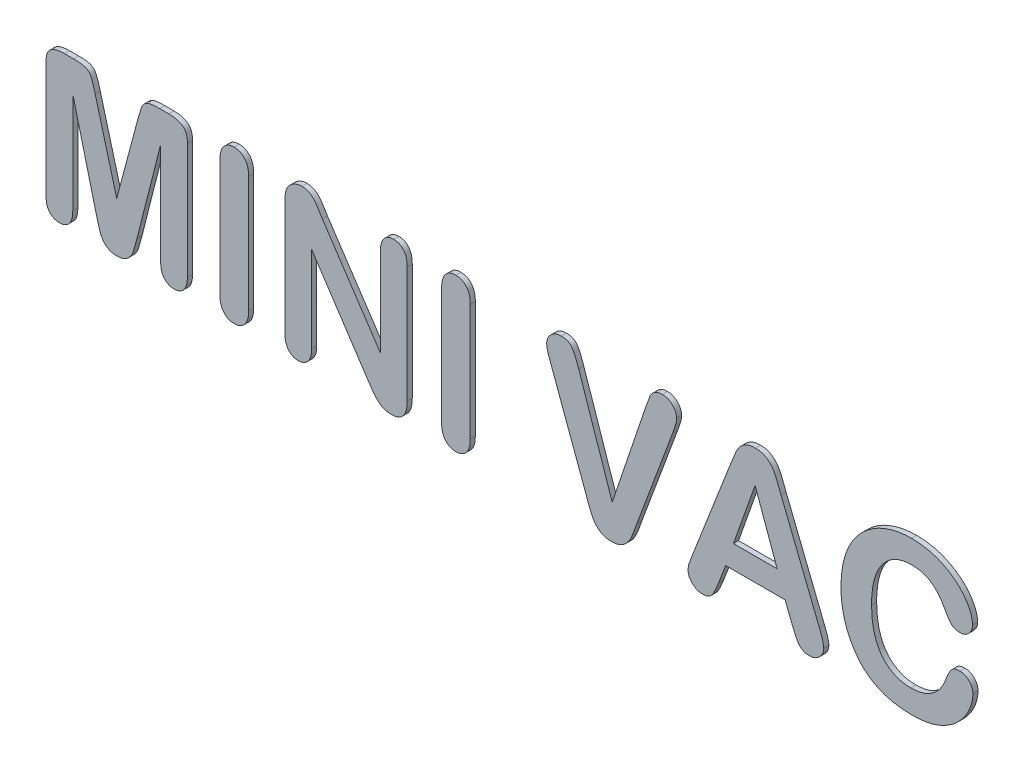
from build123d import *

# Parameters (mm, degrees)
MINI_VAC_DEPTH   = 1
MINI_VAC_2_DEPTH = 1
MINI_VAC_3_DEPTH = 1
MINI_VAC_4_DEPTH = 1
MINI_VAC_5_DEPTH = 1
MINI_VAC_6_DEPTH = 1
MINI_VAC_7_DEPTH = 1


with BuildPart() as part:
    # Sketch7 → Mini Vac (new body)
    with BuildSketch(Plane.XY):
        with BuildLine():
            Line((-80.642578125, -10.529296875), (-85.3125, 7.875))
            Line((-85.3125, 7.875), (-85.3125, -12.064453125))
            add(Edge.make_bspline(
                [(-85.3125, -12.064453125), (-85.32034702, -12.32500066), (-85.335043204, -12.812963521), (-85.472247997, -13.494771432), (-85.686102404, -14.080718367), (-86.012322646, -14.555773673), (-86.408775185, -14.923516324), (-86.867808028, -15.191623767), (-87.390721283, -15.346024223), (-87.75874176, -15.365117737), (-87.94921875, -15.375)],
                knots=[0, 0, 0, 0, 1.30362474, 2.441475632, 3.469867302, 4.406120522, 5.299256138, 6.158467928, 7.046875082, 8, 8, 8, 8], degree=3))
            add(Edge.make_bspline(
                [(-87.94921875, -15.375), (-88.133969739, -15.36523301), (-88.492628272, -15.346272275), (-89.002813758, -15.187900018), (-89.45986042, -14.930237159), (-89.8591632, -14.567396788), (-90.178253139, -14.093533639), (-90.408277762, -13.515206628), (-90.538119039, -12.83186005), (-90.55403496, -12.342370893), (-90.5625, -12.08203125)],
                knots=[0, 0, 0, 0, 0.931401934, 1.808137819, 2.66942439, 3.563139973, 4.50699297, 5.529036112, 6.685793447, 8, 8, 8, 8], degree=3))
            Line((-90.5625, -12.08203125), (-90.5625, 10.67578125))
            add(Edge.make_bspline(
                [(-90.5625, 10.67578125), (-90.558224811, 10.826232174), (-90.549991456, 11.115977498), (-90.512751288, 11.532263713), (-90.436944469, 11.911734407), (-90.326713542, 12.249314653), (-90.188860856, 12.549961029), (-90.027660667, 12.816862312), (-89.825937933, 13.04208306), (-89.510335979, 13.288096071), (-89.049596367, 13.527245272), (-88.424440329, 13.732424457), (-87.715612739, 13.854276695), (-87.215338068, 13.867873431), (-86.953125, 13.875)],
                knots=[0, 0, 0, 0, 0.969665939, 1.867427353, 2.689218696, 3.457225703, 4.149776576, 4.816702983, 5.458338976, 6.085245707, 7.385799533, 8.77853966, 10.311509556, 12, 12, 12, 12], degree=3))
            Line((-86.953125, 13.875), (-85.154296875, 13.875))
            add(Edge.make_bspline(
                [(-85.154296875, 13.875), (-84.902289988, 13.871885983), (-84.434733728, 13.866108449), (-83.789417401, 13.818949073), (-83.255681479, 13.726399776), (-82.817762843, 13.602271368), (-82.45947283, 13.416479763), (-82.155666276, 13.181333259), (-81.905334268, 12.879866062), (-81.702148799, 12.509506428), (-81.520848309, 12.052094429), (-81.331630684, 11.48902961), (-81.118314464, 10.810827038), (-80.987976868, 10.315098407), (-80.91796875, 10.048828125)],
                knots=[0, 0, 0, 0, 1.38803647, 2.575267475, 3.558583177, 4.368440808, 5.070869684, 5.768090105, 6.470518981, 7.212366556, 8.085347214, 9.177334938, 10.483864409, 12, 12, 12, 12], degree=3))
            Line((-80.91796875, 10.048828125), (-76.6875, -5.625))
            Line((-76.6875, -5.625), (-72.509765625, 10.048828125))
            add(Edge.make_bspline(
                [(-72.509765625, 10.048828125), (-72.439730708, 10.315082929), (-72.309343218, 10.810782743), (-72.096344278, 11.489168564), (-71.906205955, 12.051701624), (-71.72709811, 12.51149353), (-71.515641778, 12.878226363), (-71.266609902, 13.181583984), (-70.96226999, 13.416330904), (-70.602583925, 13.603511188), (-70.160099651, 13.725992249), (-69.62074615, 13.818997251), (-68.971491157, 13.865918867), (-68.502000405, 13.871828167), (-68.25, 13.875)],
                knots=[0, 0, 0, 0, 1.511478991, 2.813995637, 3.902629473, 4.772928891, 5.517843496, 6.218114959, 6.913193965, 7.613465427, 8.431097637, 9.421953472, 10.616226692, 12, 12, 12, 12], degree=3))
            Line((-68.25, 13.875), (-66.4453125, 13.875))
            add(Edge.make_bspline(
                [(-66.4453125, 13.875), (-66.181174544, 13.867803463), (-65.677074038, 13.854069056), (-64.963988241, 13.733333249), (-64.33741356, 13.526946306), (-63.875615132, 13.288761489), (-63.561037854, 13.040158003), (-63.352162019, 12.819285302), (-63.194119984, 12.547995226), (-63.044565896, 12.252298128), (-62.94827577, 11.909396421), (-62.859218487, 11.533433686), (-62.82587644, 11.115760128), (-62.81707182, 10.826157881), (-62.8125, 10.67578125)],
                knots=[0, 0, 0, 0, 1.69575107, 3.236297379, 4.624693315, 5.921190494, 6.546141798, 7.194208304, 7.859054455, 8.55478081, 9.316580419, 10.138397467, 11.033358612, 12, 12, 12, 12], degree=3))
            Line((-62.8125, 10.67578125), (-62.8125, -12.08203125))
            add(Edge.make_bspline(
                [(-62.8125, -12.08203125), (-62.820570537, -12.340567609), (-62.835738501, -12.826467177), (-62.97087152, -13.505150767), (-63.187998283, -14.087568046), (-63.510368049, -14.561667396), (-63.911737649, -14.925014816), (-64.373873344, -15.191724292), (-64.902566991, -15.345987173), (-65.274385115, -15.365106144), (-65.466796875, -15.375)],
                knots=[0, 0, 0, 0, 1.293518314, 2.431070022, 3.450077594, 4.386084638, 5.272371044, 6.139835868, 7.037385671, 8, 8, 8, 8], degree=3))
            add(Edge.make_bspline(
                [(-65.466796875, -15.375), (-65.649533165, -15.365101303), (-66.004243776, -15.345886877), (-66.51069347, -15.189036409), (-66.961114104, -14.921806724), (-67.357345583, -14.556084434), (-67.681715015, -14.07940898), (-67.904657324, -13.49629044), (-68.039333442, -12.812714991), (-68.054435998, -12.32491415), (-68.0625, -12.064453125)],
                knots=[0, 0, 0, 0, 0.922456205, 1.790585791, 2.649061979, 3.550299627, 4.495046019, 5.536376652, 6.684549498, 8, 8, 8, 8], degree=3))
            Line((-68.0625, -12.064453125), (-68.0625, 7.875))
            Line((-68.0625, 7.875), (-72.732421875, -10.529296875))
            add(Edge.make_bspline(
                [(-72.732421875, -10.529296875), (-72.803516938, -10.808897971), (-72.935570486, -11.328235248), (-73.135608243, -12.044458996), (-73.313178443, -12.641495873), (-73.461462438, -13.144959233), (-73.644935953, -13.577997587), (-73.879895499, -13.975150031), (-74.188049989, -14.343503114), (-74.535324782, -14.703429092), (-74.963056172, -15.009540968), (-75.471970202, -15.226355236), (-76.056053086, -15.356111613), (-76.469989365, -15.368493633), (-76.6875, -15.375)],
                knots=[0, 0, 0, 0, 1.501096557, 2.788170037, 3.868651286, 4.742863802, 5.516817816, 6.309819568, 7.133547599, 8.010237478, 8.906902995, 9.849006967, 10.869720086, 12, 12, 12, 12], degree=3))
            add(Edge.make_bspline(
                [(-76.6875, -15.375), (-76.853895408, -15.369406683), (-77.175155416, -15.358607653), (-77.636088086, -15.27506555), (-78.060020607, -15.141454683), (-78.441552081, -14.945963447), (-78.780636227, -14.706277588), (-79.076100301, -14.429508999), (-79.343676579, -14.135082446), (-79.632141698, -13.684984669), (-79.926144158, -13.066444917), (-80.186675225, -12.25953491), (-80.401640313, -11.403082144), (-80.56133994, -10.823915343), (-80.642578125, -10.529296875)],
                knots=[0, 0, 0, 0, 0.868933015, 1.67765103, 2.439282522, 3.183205666, 3.908055228, 4.601401517, 5.295498424, 5.980457608, 7.386244959, 8.861049734, 10.403235965, 12, 12, 12, 12], degree=3))
        make_face()
    extrude(amount=MINI_VAC_DEPTH)


with BuildPart() as body_2:
    # Sketch7 → Mini Vac 2 (new body)
    with BuildSketch(Plane.XY):
        with BuildLine():
            Line((-56.4375, -11.794921875), (-56.4375, 11.0625))
            add(Edge.make_bspline(
                [(-56.4375, 11.0625), (-56.430638717, 11.342671712), (-56.417764505, 11.868373735), (-56.268101351, 12.601462681), (-56.03654494, 13.231493536), (-55.685845466, 13.739320795), (-55.268088915, 14.140980808), (-54.777953313, 14.420579214), (-54.234995473, 14.600332523), (-53.851060694, 14.616641676), (-53.654296875, 14.625)],
                knots=[0, 0, 0, 0, 1.314663, 2.466776515, 3.501452278, 4.446007437, 5.34208644, 6.201692853, 7.078380494, 8, 8, 8, 8], degree=3))
            add(Edge.make_bspline(
                [(-53.654296875, 14.625), (-53.451685703, 14.616809267), (-53.058173778, 14.600901204), (-52.501769748, 14.420745199), (-52.002783417, 14.142773752), (-51.574032115, 13.745677552), (-51.221709347, 13.238877882), (-50.978033281, 12.611389166), (-50.833290693, 11.873802766), (-50.819726304, 11.344487722), (-50.8125, 11.0625)],
                knots=[0, 0, 0, 0, 0.939704012, 1.825095485, 2.692007845, 3.579728686, 4.520135675, 5.539530793, 6.689207656, 8, 8, 8, 8], degree=3))
            Line((-50.8125, 11.0625), (-50.8125, -11.794921875))
            add(Edge.make_bspline(
                [(-50.8125, -11.794921875), (-50.819668588, -12.076915635), (-50.833124639, -12.606242012), (-50.978929329, -13.345541456), (-51.222001096, -13.976358479), (-51.571802845, -14.489909639), (-52.004830195, -14.885123764), (-52.498761272, -15.174054966), (-53.059903364, -15.341311556), (-53.452021416, -15.363535633), (-53.654296875, -15.375)],
                knots=[0, 0, 0, 0, 1.307751878, 2.454761992, 3.480206064, 4.425894871, 5.311556588, 6.180961951, 7.061642901, 8, 8, 8, 8], degree=3))
            add(Edge.make_bspline(
                [(-53.654296875, -15.375), (-53.848750482, -15.363353198), (-54.227400325, -15.34067396), (-54.769930172, -15.174201125), (-55.249772476, -14.879832036), (-55.675973041, -14.4842664), (-56.031616723, -13.970760483), (-56.259338684, -13.334687376), (-56.420241387, -12.601727644), (-56.431502791, -12.07527947), (-56.4375, -11.794921875)],
                knots=[0, 0, 0, 0, 0.912572231, 1.777006537, 2.632638816, 3.534642503, 4.491136576, 5.533474522, 6.686463005, 8, 8, 8, 8], degree=3))
        make_face()
    extrude(amount=MINI_VAC_2_DEPTH)


with BuildPart() as body_3:
    # Sketch7 → Mini Vac 3 (new body)
    with BuildSketch(Plane.XY):
        with BuildLine():
            Line((-36.33984375, 11.103515625), (-24.9375, -6))
            Line((-24.9375, -6), (-24.9375, 11.26171875))
            add(Edge.make_bspline(
                [(-24.9375, 11.26171875), (-24.928697466, 11.525938907), (-24.912209928, 12.020835033), (-24.78695397, 12.714726134), (-24.567478983, 13.303340874), (-24.25646713, 13.786711922), (-23.869785214, 14.164771038), (-23.413214659, 14.433347952), (-22.895735525, 14.597940159), (-22.530542237, 14.61577981), (-22.341796875, 14.625)],
                knots=[0, 0, 0, 0, 1.319117216, 2.470765316, 3.505116792, 4.43580569, 5.318756254, 6.18027265, 7.059497782, 8, 8, 8, 8], degree=3))
            add(Edge.make_bspline(
                [(-22.341796875, 14.625), (-22.147308708, 14.615606677), (-21.770859331, 14.597425053), (-21.238490423, 14.436183197), (-20.773198147, 14.164818617), (-20.380397186, 13.787266712), (-20.063715887, 13.30387908), (-19.836534268, 12.715983917), (-19.713290045, 12.020664749), (-19.696476556, 11.525879638), (-19.6875, 11.26171875)],
                knots=[0, 0, 0, 0, 0.959871134, 1.857917088, 2.719075999, 3.600089629, 4.526699118, 5.554128738, 6.694173474, 8, 8, 8, 8], degree=3))
            Line((-19.6875, 11.26171875), (-19.6875, -11.5546875))
            add(Edge.make_bspline(
                [(-19.6875, -11.5546875), (-19.694738264, -11.85418102), (-19.708323647, -12.416295692), (-19.853060568, -13.20227919), (-20.097149154, -13.871296534), (-20.43866617, -14.426385705), (-20.888152229, -14.861885499), (-21.443828562, -15.161225781), (-22.091707736, -15.348184467), (-22.55526269, -15.365763473), (-22.798828125, -15.375)],
                knots=[0, 0, 0, 0, 1.276164049, 2.395212213, 3.391561633, 4.297456637, 5.151673506, 6.027862746, 6.963780962, 8, 8, 8, 8], degree=3))
            add(Edge.make_bspline(
                [(-22.798828125, -15.375), (-23.04576548, -15.363413763), (-23.522041551, -15.341067014), (-24.208166679, -15.177915778), (-24.832007481, -14.873539695), (-25.392540568, -14.43343074), (-25.917288605, -13.899653001), (-26.397611967, -13.280521353), (-26.850145236, -12.609747646), (-27.159867422, -12.158005576), (-27.31640625, -11.9296875)],
                knots=[0, 0, 0, 0, 0.990229924, 1.909888509, 2.806876858, 3.75171819, 4.754420985, 5.802993103, 6.889595585, 8, 8, 8, 8], degree=3))
            Line((-27.31640625, -11.9296875), (-38.4375, 4.875))
            Line((-38.4375, 4.875), (-38.4375, -12.029296875))
            add(Edge.make_bspline(
                [(-38.4375, -12.029296875), (-38.446282155, -12.287632755), (-38.462917794, -12.776986674), (-38.591368554, -13.465102491), (-38.827671505, -14.052638994), (-39.152334188, -14.535807007), (-39.551020474, -14.911743915), (-40.006805024, -15.182392004), (-40.518266476, -15.347449896), (-40.877666928, -15.365643409), (-41.0625, -15.375)],
                knots=[0, 0, 0, 0, 1.293064309, 2.449392962, 3.484384031, 4.441729672, 5.340986808, 6.204611779, 7.076664708, 8, 8, 8, 8], degree=3))
            add(Edge.make_bspline(
                [(-41.0625, -15.375), (-41.25126065, -15.365993602), (-41.61894229, -15.348450288), (-42.139400721, -15.178890228), (-42.597150231, -14.899062074), (-42.996897394, -14.521002828), (-43.307938605, -14.028721179), (-43.530101607, -13.441157134), (-43.663536021, -12.757841322), (-43.679198884, -12.270175406), (-43.6875, -12.01171875)],
                knots=[0, 0, 0, 0, 0.938889884, 1.828837584, 2.693878765, 3.596100726, 4.546832571, 5.570326044, 6.712304089, 8, 8, 8, 8], degree=3))
            Line((-43.6875, -12.01171875), (-43.6875, 10.37109375))
            add(Edge.make_bspline(
                [(-43.6875, 10.37109375), (-43.685301746, 10.595916801), (-43.681145053, 11.021036014), (-43.619664008, 11.619633099), (-43.535650224, 12.146455797), (-43.431505259, 12.461893001), (-43.3828125, 12.609375)],
                knots=[0, 0, 0, 0, 1.18793306, 2.246269525, 3.180047019, 4, 4, 4, 4], degree=3))
            add(Edge.make_bspline(
                [(-43.3828125, 12.609375), (-43.317473183, 12.752881282), (-43.187026876, 13.039383581), (-42.900988709, 13.419010244), (-42.574517488, 13.772823149), (-42.180524041, 14.064311459), (-41.755415513, 14.312047313), (-41.304564876, 14.49514501), (-40.833361118, 14.605060917), (-40.514242503, 14.618321295), (-40.353515625, 14.625)],
                knots=[0, 0, 0, 0, 0.980600708, 1.957714689, 2.948627098, 3.97434472, 5.000279326, 6.011426356, 6.998437519, 8, 8, 8, 8], degree=3))
            add(Edge.make_bspline(
                [(-40.353515625, 14.625), (-40.113342952, 14.615444869), (-39.66297532, 14.597527252), (-39.041974086, 14.390113251), (-38.513318355, 14.086062857), (-38.056160188, 13.671045411), (-37.62390522, 13.158137939), (-37.22328386, 12.525802782), (-36.789457737, 11.831128742), (-36.492001151, 11.349752896), (-36.33984375, 11.103515625)],
                knots=[0, 0, 0, 0, 1.01695463, 1.906975685, 2.751376853, 3.592506721, 4.517315556, 5.594915983, 6.76973195, 8, 8, 8, 8], degree=3))
        make_face()
    extrude(amount=MINI_VAC_3_DEPTH)


with BuildPart() as body_4:
    # Sketch7 → Mini Vac 4 (new body)
    with BuildSketch(Plane.XY):
        with BuildLine():
            Line((-12.9375, -11.794921875), (-12.9375, 11.0625))
            add(Edge.make_bspline(
                [(-12.9375, 11.0625), (-12.930638717, 11.342671712), (-12.917764505, 11.868373735), (-12.768101351, 12.601462681), (-12.53654494, 13.231493536), (-12.185845466, 13.739320795), (-11.768088915, 14.140980808), (-11.277953313, 14.420579214), (-10.734995473, 14.600332523), (-10.351060694, 14.616641676), (-10.154296875, 14.625)],
                knots=[0, 0, 0, 0, 1.314663, 2.466776515, 3.501452278, 4.446007437, 5.34208644, 6.201692853, 7.078380494, 8, 8, 8, 8], degree=3))
            add(Edge.make_bspline(
                [(-10.154296875, 14.625), (-9.951685703, 14.616809267), (-9.558173778, 14.600901204), (-9.001769748, 14.420745199), (-8.502783417, 14.142773752), (-8.074032115, 13.745677552), (-7.721709347, 13.238877882), (-7.478033281, 12.611389166), (-7.333290693, 11.873802766), (-7.319726304, 11.344487722), (-7.3125, 11.0625)],
                knots=[0, 0, 0, 0, 0.939704012, 1.825095485, 2.692007845, 3.579728686, 4.520135675, 5.539530793, 6.689207656, 8, 8, 8, 8], degree=3))
            Line((-7.3125, 11.0625), (-7.3125, -11.794921875))
            add(Edge.make_bspline(
                [(-7.3125, -11.794921875), (-7.319668588, -12.076915635), (-7.333124639, -12.606242012), (-7.478929329, -13.345541456), (-7.722001096, -13.976358479), (-8.071802845, -14.489909639), (-8.504830195, -14.885123764), (-8.998761272, -15.174054966), (-9.559903364, -15.341311556), (-9.952021416, -15.363535633), (-10.154296875, -15.375)],
                knots=[0, 0, 0, 0, 1.307751878, 2.454761992, 3.480206064, 4.425894871, 5.311556588, 6.180961951, 7.061642901, 8, 8, 8, 8], degree=3))
            add(Edge.make_bspline(
                [(-10.154296875, -15.375), (-10.348750482, -15.363353198), (-10.727400325, -15.34067396), (-11.269930172, -15.174201125), (-11.749772476, -14.879832036), (-12.175973041, -14.4842664), (-12.531616723, -13.970760483), (-12.759338684, -13.334687376), (-12.920241387, -12.601727644), (-12.931502791, -12.07527947), (-12.9375, -11.794921875)],
                knots=[0, 0, 0, 0, 0.912572231, 1.777006537, 2.632638816, 3.534642503, 4.491136576, 5.533474522, 6.686463005, 8, 8, 8, 8], degree=3))
        make_face()
    extrude(amount=MINI_VAC_4_DEPTH)


with BuildPart() as body_5:
    # Sketch7 → Mini Vac 5 (new body)
    with BuildSketch(Plane.XY):
        with BuildLine():
            Line((13.95703125, 10.775390625), (20.548828125, -8.625))
            Line((20.548828125, -8.625), (27.15234375, 10.916015625))
            add(Edge.make_bspline(
                [(27.15234375, 10.916015625), (27.23139187, 11.1526998), (27.376783297, 11.588027676), (27.59053756, 12.180160409), (27.762287896, 12.658955548), (27.912727602, 13.039978253), (28.07372604, 13.354525222), (28.268027736, 13.63659312), (28.505444276, 13.900750176), (28.780265662, 14.150809571), (29.109073638, 14.365122853), (29.497742046, 14.515676305), (29.93672058, 14.612124506), (30.24749252, 14.620576219), (30.41015625, 14.625)],
                knots=[0, 0, 0, 0, 1.663677355, 3.059964321, 4.196999397, 5.055473659, 5.789349626, 6.547882397, 7.331919154, 8.152727381, 9.019653913, 9.931296846, 10.917202845, 12, 12, 12, 12], degree=3))
            add(Edge.make_bspline(
                [(30.41015625, 14.625), (30.533551864, 14.620604077), (30.778470991, 14.611878923), (31.138993995, 14.53835959), (31.486304556, 14.421907353), (31.814624983, 14.256599722), (32.117074014, 14.052806973), (32.388794383, 13.816928815), (32.627891384, 13.550594144), (32.880735212, 13.16176469), (33.129302155, 12.649235379), (33.168493789, 12.208081011), (33.1875, 11.994140625)],
                knots=[0, 0, 0, 0, 0.876180247, 1.739067481, 2.603738925, 3.472744031, 4.342746148, 5.188837289, 6.024504381, 6.875250335, 8.484634405, 10, 10, 10, 10], degree=3))
            add(Edge.make_bspline(
                [(33.1875, 11.994140625), (33.181810266, 11.843287212), (33.169815233, 11.525259768), (33.067563828, 11.044590422), (32.934855119, 10.550244911), (32.768097134, 10.060198857), (32.584953617, 9.568152049), (32.47181523, 9.234678404), (32.4140625, 9.064453125)],
                knots=[0, 0, 0, 0, 0.891094485, 1.87859523, 2.895504577, 3.918037669, 4.937239494, 6, 6, 6, 6], degree=3))
            Line((32.4140625, 9.064453125), (25.37109375, -9.890625))
            add(Edge.make_bspline(
                [(25.37109375, -9.890625), (25.24405984, -10.244099655), (24.995183081, -10.936604728), (24.634381159, -11.944996927), (24.238592598, -12.869932822), (23.845566915, -13.561609079), (23.478352024, -14.045832772), (23.16675661, -14.369587075), (22.812033417, -14.657579202), (22.419300256, -14.911708176), (21.98080764, -15.118653513), (21.498820894, -15.271745047), (20.968049453, -15.359816891), (20.599946093, -15.369799904), (20.408203125, -15.375)],
                knots=[0, 0, 0, 0, 1.681776409, 3.294829421, 4.794504194, 6.181843062, 6.842986488, 7.510919311, 8.188344572, 8.884531222, 9.600376859, 10.352632466, 11.141895525, 12, 12, 12, 12], degree=3))
            add(Edge.make_bspline(
                [(20.408203125, -15.375), (20.216318608, -15.370262236), (19.847943507, -15.361166796), (19.318329364, -15.266812289), (18.829043297, -15.135010189), (18.391873541, -14.92199346), (17.996295117, -14.670200812), (17.645859889, -14.37489409), (17.32846118, -14.049314096), (16.960308145, -13.554562247), (16.564220977, -12.85661734), (16.158500334, -11.936299067), (15.794798613, -10.934451867), (15.552118666, -10.24433874), (15.427734375, -9.890625)],
                knots=[0, 0, 0, 0, 0.856404827, 1.644104592, 2.398160278, 3.112588039, 3.807395751, 4.489033182, 5.15564303, 5.834649402, 7.2387151, 8.73098538, 10.324484289, 12, 12, 12, 12], degree=3))
            Line((15.427734375, -9.890625), (8.501953125, 8.90625))
            add(Edge.make_bspline(
                [(8.501953125, 8.90625), (8.442578155, 9.07660316), (8.324814386, 9.41448005), (8.126658798, 9.915594116), (7.954597842, 10.438633025), (7.812843073, 10.971630799), (7.716217687, 11.481193555), (7.69643259, 11.806331484), (7.6875, 11.953125)],
                knots=[0, 0, 0, 0, 1.024828865, 2.032636131, 3.060763648, 4.150798767, 5.165121243, 6, 6, 6, 6], degree=3))
            add(Edge.make_bspline(
                [(7.6875, 11.953125), (7.698119189, 12.11832778), (7.719431703, 12.449886684), (7.879119839, 12.931327481), (8.140110397, 13.386928315), (8.492669656, 13.806033232), (8.921226749, 14.169455975), (9.414206521, 14.439177497), (9.965233513, 14.596193303), (10.348588959, 14.615179576), (10.546875, 14.625)],
                knots=[0, 0, 0, 0, 0.914541686, 1.83546813, 2.780759257, 3.810599709, 4.85568952, 5.877762653, 6.902297996, 8, 8, 8, 8], degree=3))
            add(Edge.make_bspline(
                [(10.546875, 14.625), (10.780586987, 14.615120568), (11.218069173, 14.596627398), (11.823143347, 14.4254167), (12.327235308, 14.137548311), (12.702981468, 13.694833282), (13.016408959, 13.14667011), (13.331836779, 12.478843386), (13.651096886, 11.67542624), (13.850466362, 11.088896415), (13.95703125, 10.775390625)],
                knots=[0, 0, 0, 0, 0.996023746, 1.864442861, 2.661172804, 3.434868426, 4.310268675, 5.354837269, 6.586135273, 8, 8, 8, 8], degree=3))
        make_face()
    extrude(amount=MINI_VAC_5_DEPTH)


with BuildPart() as body_6:
    # Sketch7 → Mini Vac 6 (new body)
    with BuildSketch(Plane.XY):
        with BuildLine():
            Line((55.857421875, -11.748046875), (54.486328125, -8.25))
            Line((54.486328125, -8.25), (42.8203125, -8.25))
            Line((42.8203125, -8.25), (41.44921875, -11.82421875))
            add(Edge.make_bspline(
                [(41.44921875, -11.82421875), (41.323320189, -12.145761274), (41.092568487, -12.735096723), (40.734913745, -13.525500667), (40.41072569, -14.148374662), (40.11010715, -14.632122254), (39.759460605, -14.988782463), (39.319773263, -15.217282574), (38.795010592, -15.351859021), (38.416918186, -15.366939904), (38.21484375, -15.375)],
                knots=[0, 0, 0, 0, 1.589179946, 2.912709847, 3.990397165, 4.820646782, 5.526248733, 6.26234321, 7.071295771, 8, 8, 8, 8], degree=3))
            add(Edge.make_bspline(
                [(38.21484375, -15.375), (38.035938456, -15.364917991), (37.683129334, -15.345035826), (37.173169162, -15.183636421), (36.697095397, -14.926246776), (36.26519746, -14.578337743), (35.900446272, -14.167501273), (35.636127517, -13.71074287), (35.466612065, -13.226548741), (35.447244899, -12.890028605), (35.4375, -12.720703125)],
                knots=[0, 0, 0, 0, 1.012468346, 1.996632184, 3.002236258, 4.065667855, 5.124941345, 6.097262832, 7.042607408, 8, 8, 8, 8], degree=3))
            add(Edge.make_bspline(
                [(35.4375, -12.720703125), (35.446531553, -12.518706445), (35.465084047, -12.103767617), (35.597051481, -11.580527955), (35.755494163, -11.128146158), (35.901888745, -10.717866543), (36.075772262, -10.243694481), (36.209968913, -9.909784482), (36.28125, -9.732421875)],
                knots=[0, 0, 0, 0, 1.162779838, 2.388566498, 3.08974091, 3.926345762, 4.898539362, 6, 6, 6, 6], degree=3))
            Line((36.28125, -9.732421875), (43.623046875, 9.10546875))
            add(Edge.make_bspline(
                [(43.623046875, 9.10546875), (43.677334086, 9.248202136), (43.790545929, 9.545861743), (43.976567651, 10.010205938), (44.165386959, 10.51858401), (44.373060625, 11.052262188), (44.584385364, 11.586763864), (44.822317755, 12.081944487), (45.051898506, 12.536552895), (45.301148972, 12.941351118), (45.5726851, 13.306862013), (45.883855799, 13.629693717), (46.236506499, 13.912974868), (46.622593675, 14.169049235), (47.057767305, 14.37445966), (47.540925904, 14.521726252), (48.071007065, 14.609671426), (48.441058621, 14.619768094), (48.6328125, 14.625)],
                knots=[0, 0, 0, 0, 0.906149852, 1.889706515, 2.96811083, 4.12389095, 5.288239382, 6.376994434, 7.382631969, 8.308939681, 9.194397083, 10.07962691, 10.961131357, 11.874074475, 12.822804478, 13.805267996, 14.862730428, 16, 16, 16, 16], degree=3))
            add(Edge.make_bspline(
                [(48.6328125, 14.625), (48.826542868, 14.619821261), (49.200521882, 14.609824171), (49.736037237, 14.521096731), (50.222844318, 14.377508473), (50.654172446, 14.166496196), (51.043033858, 13.917869884), (51.396886615, 13.639146226), (51.704680194, 13.316984387), (52.06123778, 12.844477868), (52.444836054, 12.204133288), (52.765764992, 11.513065873), (52.998468564, 10.904860194), (53.216124591, 10.38367412), (53.439991862, 9.785343641), (53.599484932, 9.363228049), (53.68359375, 9.140625)],
                knots=[0, 0, 0, 0, 1.005463131, 1.940955953, 2.810500616, 3.631666672, 4.42517864, 5.204561669, 5.964968357, 6.731842121, 8.274852444, 9.831306624, 10.68267648, 11.656482744, 12.764143998, 14, 14, 14, 14], degree=3))
            Line((53.68359375, 9.140625), (61.18359375, -9.57421875))
            add(Edge.make_bspline(
                [(61.18359375, -9.57421875), (61.252154058, -9.74599155), (61.38417767, -10.076766984), (61.570904869, -10.554291103), (61.710122474, -11.002177809), (61.848602189, -11.405951833), (61.937016386, -11.780088302), (62.010409867, -12.113213195), (62.055767921, -12.410839694), (62.060342864, -12.59752342), (62.0625, -12.685546875)],
                knots=[0, 0, 0, 0, 1.36622511, 2.630880465, 3.785062113, 4.829837655, 5.781525877, 6.621841003, 7.350182692, 8, 8, 8, 8], degree=3))
            add(Edge.make_bspline(
                [(62.0625, -12.685546875), (62.051724288, -12.850660922), (62.030097634, -13.182041739), (61.871657682, -13.66834053), (61.596581711, -14.123425801), (61.240179644, -14.550145385), (60.811335258, -14.916062596), (60.320542352, -15.181981906), (59.787713158, -15.34588331), (59.415215921, -15.365211251), (59.2265625, -15.375)],
                knots=[0, 0, 0, 0, 0.918533131, 1.843478885, 2.81316186, 3.862812883, 4.927781559, 5.930017069, 6.951644948, 8, 8, 8, 8], degree=3))
            add(Edge.make_bspline(
                [(59.2265625, -15.375), (59.012270917, -15.365584078), (58.608531659, -15.347843871), (58.050233773, -15.167699728), (57.592716081, -14.87336917), (57.26930485, -14.558612739), (57.046810106, -14.244709812), (56.871757642, -13.956363404), (56.690881182, -13.615502228), (56.450012029, -13.10562055), (56.178893851, -12.474090294), (55.959387308, -11.978335475), (55.857421875, -11.748046875)],
                knots=[0, 0, 0, 0, 1.202315025, 2.265239587, 3.252603888, 4.239051274, 4.781746036, 5.412840692, 6.135219166, 6.950797606, 8.583580985, 10, 10, 10, 10], degree=3))
        make_face()
        Polygon((44.34375, -3.75), (52.921875, -3.75), (48.591796875, 8.25), align=None, mode=Mode.SUBTRACT)
    extrude(amount=MINI_VAC_6_DEPTH)


with BuildPart() as body_7:
    # Sketch7 → Mini Vac 7 (new body)
    with BuildSketch(Plane.XY):
        with BuildLine():
            add(Edge.make_bspline(
                [(91.330078125, -5.806640625), (91.322119375, -6.039622355), (91.305686748, -6.520665442), (91.167486766, -7.252410105), (90.955834875, -8.013744669), (90.65489058, -8.795824573), (90.272694802, -9.593558912), (89.777238725, -10.382167475), (89.190893309, -11.167182791), (88.50828771, -11.93885052), (87.728217095, -12.671353716), (86.836629631, -13.33321547), (85.846234667, -13.921650159), (84.758312685, -14.439999446), (83.573505866, -14.866203895), (82.284974229, -15.159151901), (80.905856427, -15.345441349), (79.953755875, -15.364971231), (79.46484375, -15.375)],
                knots=[0, 0, 0, 0, 0.663733519, 1.370426865, 2.116139696, 2.914458905, 3.756161797, 4.633801399, 5.564768272, 6.546895284, 7.567232022, 8.609557965, 9.705783212, 10.846455846, 12.040496113, 13.287086875, 14.606894913, 16, 16, 16, 16], degree=3))
            add(Edge.make_bspline(
                [(79.46484375, -15.375), (79.091609439, -15.371863914), (78.361755311, -15.365731345), (77.292414495, -15.277887319), (76.272779212, -15.153015855), (75.302930642, -14.97344467), (74.381060096, -14.730911081), (73.504148604, -14.43268281), (72.665272844, -14.081647728), (71.871271704, -13.664048277), (71.114396438, -13.177478388), (70.38984113, -12.626928695), (69.690161144, -12.009730388), (69.263704707, -11.548807256), (69.046875, -11.314453125)],
                knots=[0, 0, 0, 0, 1.162398207, 2.273052359, 3.340187725, 4.361698781, 5.343118899, 6.307107414, 7.245071305, 8.173155143, 9.098082292, 10.044846171, 11.00591152, 12, 12, 12, 12], degree=3))
            add(Edge.make_bspline(
                [(69.046875, -11.314453125), (68.858571989, -11.080254916), (68.481144243, -10.610836494), (67.961759605, -9.86378692), (67.498693678, -9.069162505), (67.058592252, -8.245566649), (66.682839878, -7.376881865), (66.347672562, -6.482009814), (66.063952925, -5.556846003), (65.839343568, -4.60082015), (65.653001772, -3.618195554), (65.537393976, -2.603519494), (65.44688614, -1.564119829), (65.44064886, -0.859586475), (65.4375, -0.50390625)],
                knots=[0, 0, 0, 0, 0.929575355, 1.863207229, 2.811429804, 3.773642551, 4.750392879, 5.73698116, 6.729013264, 7.741753443, 8.774044155, 9.821085133, 10.899985467, 12, 12, 12, 12], degree=3))
            add(Edge.make_bspline(
                [(65.4375, -0.50390625), (65.449019723, 0.06897356), (65.471499395, 1.186895517), (65.671313929, 2.815286314), (65.981137049, 4.35525123), (66.434488403, 5.798357825), (67.005544838, 7.147266188), (67.681682885, 8.400280721), (68.482101263, 9.546294523), (69.383156068, 10.589421428), (70.382020251, 11.52304026), (71.463204951, 12.341586085), (72.626991398, 13.037295396), (73.864619132, 13.611476792), (75.163870361, 14.058385259), (76.507817889, 14.391727427), (77.894564475, 14.588008973), (78.833373796, 14.612602208), (79.306640625, 14.625)],
                knots=[0, 0, 0, 0, 1.192086909, 2.32624733, 3.409866705, 4.457877143, 5.469000883, 6.455088314, 7.416011801, 8.372962001, 9.319325461, 10.256879636, 11.190511563, 12.136385829, 13.091719595, 14.046248446, 15.015086683, 16, 16, 16, 16], degree=3))
            add(Edge.make_bspline(
                [(79.306640625, 14.625), (79.595808319, 14.620046854), (80.167045051, 14.610262155), (81.012399148, 14.546105108), (81.833639808, 14.433793952), (82.631649734, 14.281354109), (83.405923037, 14.090677734), (84.154795907, 13.847385717), (84.879218519, 13.562285799), (85.574885608, 13.231694305), (86.240836127, 12.877545106), (86.866995219, 12.495404605), (87.456440989, 12.098114401), (88.002582227, 11.673262856), (88.512099831, 11.23193579), (88.975663486, 10.764053206), (89.407674646, 10.285250073), (89.789264711, 9.781474461), (90.135471902, 9.27718639), (90.42857686, 8.76950306), (90.679478125, 8.272080059), (90.897288978, 7.784680647), (91.053292158, 7.298435497), (91.16472877, 6.820101404), (91.240290299, 6.350040386), (91.24940165, 6.037386693), (91.25390625, 5.8828125)],
                knots=[0, 0, 0, 0, 1.284700242, 2.537862918, 3.763812693, 4.965289083, 6.145935712, 7.303948861, 8.460888676, 9.602102237, 10.724019168, 11.810373379, 12.859709494, 13.88027226, 14.88267171, 15.852117704, 16.804758353, 17.745428632, 18.657571087, 19.520770973, 20.347343408, 21.132381758, 21.889741149, 22.611674871, 23.313620019, 24, 24, 24, 24], degree=3))
            add(Edge.make_bspline(
                [(91.25390625, 5.8828125), (91.244051459, 5.719976986), (91.2246186, 5.398878402), (91.094211011, 4.928889336), (90.856340481, 4.498980998), (90.551125127, 4.103815903), (90.180869404, 3.771242574), (89.763041623, 3.525728248), (89.305768311, 3.369000171), (88.985639599, 3.353575121), (88.822265625, 3.345703125)],
                knots=[0, 0, 0, 0, 1.005202555, 1.982178884, 2.979908251, 4.019228851, 5.052378826, 6.030321538, 6.994797445, 8, 8, 8, 8], degree=3))
            add(Edge.make_bspline(
                [(88.822265625, 3.345703125), (88.646040148, 3.352347597), (88.311937326, 3.364944736), (87.843799588, 3.460635135), (87.445823628, 3.631801296), (87.108309563, 3.881809387), (86.818492557, 4.226964959), (86.515880021, 4.649707961), (86.192907065, 5.168466724), (85.985957985, 5.553386649), (85.875, 5.759765625)],
                knots=[0, 0, 0, 0, 1.03602979, 1.964190893, 2.792215287, 3.564084538, 4.410155262, 5.430272824, 6.62221301, 8, 8, 8, 8], degree=3))
            add(Edge.make_bspline(
                [(85.875, 5.759765625), (85.682988194, 6.105983656), (85.312558911, 6.773907677), (84.659210785, 7.670196633), (83.954145303, 8.427603973), (83.194045591, 9.053196634), (82.355788348, 9.537591505), (81.433095803, 9.886762038), (80.416541405, 10.084573753), (79.711791541, 10.111228059), (79.34765625, 10.125)],
                knots=[0, 0, 0, 0, 1.14083101, 2.200891824, 3.189077095, 4.117958574, 5.028926365, 5.968284059, 6.950238216, 8, 8, 8, 8], degree=3))
            add(Edge.make_bspline(
                [(79.34765625, 10.125), (79.054079835, 10.118564181), (78.477338427, 10.105920784), (77.63730625, 9.963743517), (76.840824862, 9.752129596), (76.093110755, 9.440023045), (75.387862293, 9.049691967), (74.732143254, 8.562817458), (74.125925253, 7.987756924), (73.563107633, 7.332248259), (73.05975723, 6.593545418), (72.626908171, 5.778395858), (72.254049637, 4.895112456), (71.961172247, 3.933279533), (71.715815853, 2.901269042), (71.559836407, 1.790930905), (71.457185873, 0.611315237), (71.444180751, -0.198982942), (71.4375, -0.615234375)],
                knots=[0, 0, 0, 0, 0.93671651, 1.840213212, 2.713397844, 3.56368846, 4.421020421, 5.281885359, 6.164466969, 7.084649485, 8.036264718, 9.013062724, 10.027939462, 11.093339593, 12.220621858, 13.412469407, 14.670781518, 16, 16, 16, 16], degree=3))
            add(Edge.make_bspline(
                [(71.4375, -0.615234375), (71.441802256, -0.896519254), (71.450202081, -1.445706405), (71.488769921, -2.253342254), (71.564876845, -3.023607525), (71.672373983, -3.757981746), (71.797099988, -4.457646045), (71.961577657, -5.118616448), (72.156881074, -5.744007614), (72.3753425, -6.335026595), (72.633344294, -6.88631682), (72.897330725, -7.409940783), (73.19648968, -7.892929388), (73.529755683, -8.33118917), (73.873173868, -8.746332241), (74.24812481, -9.120563857), (74.649327954, -9.456060279), (75.212743916, -9.855394877), (75.975987303, -10.267261826), (76.967331021, -10.621196949), (78.03364363, -10.837522128), (78.770448931, -10.862292532), (79.1484375, -10.875)],
                knots=[0, 0, 0, 0, 1.161576005, 2.267888061, 3.337585273, 4.356077319, 5.33204537, 6.270922222, 7.166254778, 8.036538097, 8.870177389, 9.678142996, 10.45692397, 11.2117863, 11.950096439, 12.68003429, 13.395618977, 14.107193223, 15.528992878, 16.960094082, 18.440497528, 20, 20, 20, 20], degree=3))
            add(Edge.make_bspline(
                [(79.1484375, -10.875), (79.355680167, -10.872838402), (79.763421043, -10.868585551), (80.360007972, -10.799115482), (80.93444525, -10.70198215), (81.482151489, -10.560149844), (82.010006613, -10.386960837), (82.506944319, -10.160409561), (82.984858836, -9.90332158), (83.437093209, -9.604710683), (83.859382995, -9.26165121), (84.258220987, -8.885132994), (84.636956243, -8.476981309), (84.974219104, -8.020311781), (85.293433829, -7.532378747), (85.584751346, -7.005492709), (85.850379969, -6.442188049), (85.998793676, -6.047990637), (86.07421875, -5.84765625)],
                knots=[0, 0, 0, 0, 1.080453892, 2.125745732, 3.129130718, 4.117609764, 5.07455133, 6.023212249, 6.962414916, 7.903439618, 8.845456672, 9.796903999, 10.763291339, 11.745501622, 12.754406698, 13.803416246, 14.883677954, 16, 16, 16, 16], degree=3))
            add(Edge.make_bspline(
                [(86.07421875, -5.84765625), (86.137809542, -5.661052926), (86.260655355, -5.300569339), (86.483409605, -4.797452911), (86.725397565, -4.348411261), (86.983594295, -3.944270606), (87.312036896, -3.607715485), (87.730116809, -3.367872371), (88.232384231, -3.235320177), (88.590996038, -3.219389295), (88.78125, -3.2109375)],
                knots=[0, 0, 0, 0, 1.148264852, 2.218238262, 3.200956292, 4.119438462, 5.004604087, 5.912235567, 6.892380428, 8, 8, 8, 8], degree=3))
            add(Edge.make_bspline(
                [(88.78125, -3.2109375), (88.950359522, -3.219342548), (89.283000719, -3.235875416), (89.759658574, -3.385615605), (90.204461742, -3.614564322), (90.589373043, -3.945974798), (90.921023684, -4.333255898), (91.159200001, -4.783117442), (91.305511813, -5.280044999), (91.321738703, -5.627879446), (91.330078125, -5.806640625)],
                knots=[0, 0, 0, 0, 1.000050397, 1.967115494, 2.935635085, 3.946684534, 4.957733984, 5.941906876, 6.942292355, 8, 8, 8, 8], degree=3))
        make_face()
    extrude(amount=MINI_VAC_7_DEPTH)


solid = Compound([part.part, body_2.part, body_3.part, body_4.part, body_5.part, body_6.part, body_7.part])
